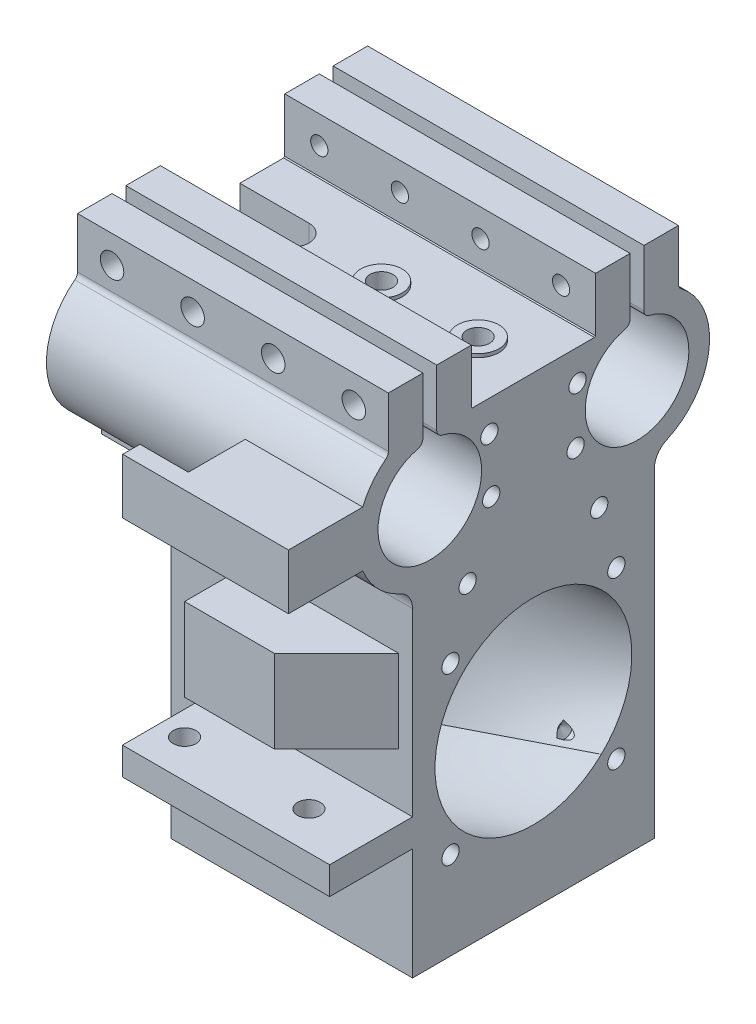
from build123d import *

# Parameters (mm, degrees)
BOSS_EXTRUDE1_DEPTH             = 35
BOSS_EXTRUDE1_DEPTH_BACK        = 10
SKETCH2_R                       = 7.5
CUT_EXTRUDE1_REACH              = 81.895
SKETCH4_R                       = 2.5
SKETCH10_W                      = 5
SKETCH10_H                      = 24.441838285
CUT_EXTRUDE2_DEPTH              = 61.815622993
CUT_EXTRUDE3_DEPTH              = 3
CUT_EXTRUDE20_START             = -10
SKETCH84_W                      = 35
SKETCH84_H                      = 45.7
CUT_EXTRUDE20_DEPTH             = 10
FILLET2_R                       = 3
SKETCH74_W                      = 13
SKETCH74_H                      = 12
PCB_MOUNT_DEPTH                 = 9
SKETCH65_W                      = 25
SKETCH65_H                      = 4
BOSS_EXTRUDE18_DEPTH            = 12
M4X0_7_TAPPED_HOLE6_D           = 3.3
M4X0_7_TAPPED_HOLE6_DEPTH       = 4
M4X0_7_TAPPED_HOLE4_D           = 3.3
M4X0_7_TAPPED_HOLE4_DEPTH       = 20
M4X0_7_TAPPED_HOLE4_TIP         = 0.991420021
SKETCH37_R                      = 3
SKETCH37_R_2                    = 1.65
BOSS_EXTRUDE11_DEPTH            = 0.5
M3X0_5_TAPPED_HOLE1_D           = 2.5
M3X0_5_TAPPED_HOLE1_DEPTH       = 7.5
M3X0_5_TAPPED_HOLE1_TIP         = 0.751075774
F_22_0_157_DIAMETER_HOLE1_D     = 3.9878
F_22_0_157_DIAMETER_HOLE1_DEPTH = 7.5
F_22_0_157_DIAMETER_HOLE1_TIP   = 1.198055988
M3X0_5_TAPPED_HOLE4_D           = 2.5
CHAMFER3_SIZE                   = 9
SKETCH100_W                     = 10.75
SKETCH100_H                     = 8
BOSS_EXTRUDE25_DEPTH            = 17
SKETCH101_W                     = 2.5
SKETCH101_H                     = 8
BOSS_EXTRUDE26_DEPTH            = 7
SKETCH105_W                     = 12
SKETCH105_H                     = 4
BOSS_EXTRUDE27_DEPTH            = 5
BOSS_EXTRUDE29_START            = -45
BOSS_EXTRUDE29_DEPTH            = 45
SKETCH107_W                     = 2
SKETCH107_H                     = 9.019238106
CUT_EXTRUDE23_DEPTH             = 72.453320969
M3_CLEARANCE_HOLE1_D            = 3.4
M3_CLEARANCE_HOLE1_DEPTH        = 5
M3X0_5_TAPPED_HOLE6_D           = 2.5
FILLET21_R                      = 1
M3X0_5_START                    = -18
M3X0_5_TAPPED_HOLE7_OUTLINE_R   = 1.25
M3X0_5_TAPPED_HOLE7_DEPTH       = 8.176239335


with BuildPart() as part:
    # Sketch2 → Boss-Extrude1 (new, two sides: drawn at the far end of the back side and taken through both)
    with BuildSketch(Plane(origin=(0, 0, 0), x_dir=(0, 0, -1), z_dir=(1, 0, 0)).offset(-BOSS_EXTRUDE1_DEPTH_BACK)):
        with BuildLine():
            Line((-17.5, -42.7), (-17.5, 5.743799258))
            ThreePointArc((-17.5, 5.743799258), (-24.526864561, 20.356456234), (-8.835585997, 24.441838285))
            Line((-8.835585997, 24.441838285), (8.835585997, 24.441838285))
            ThreePointArc((8.835585997, 24.441838285), (24.526864561, 20.356456234), (17.5, 5.743799258))
            Line((17.5, 5.743799258), (17.5, -42.7))
            Line((17.5, -42.7), (-17.5, -42.7))
        make_face()
        with Locations(Location((-15, 15.941838285, 0), (0, 0, 180))):
            Circle(SKETCH2_R, mode=Mode.SUBTRACT)
        with Locations((15, 15.941838285)):
            Circle(SKETCH2_R, mode=Mode.SUBTRACT)
    extrude(amount=BOSS_EXTRUDE1_DEPTH + BOSS_EXTRUDE1_DEPTH_BACK)

    # Sketch3 → Cut-Revolve3 (revolve, cut)
    with BuildSketch(Plane(origin=(0, 0, 0), x_dir=(0, 0, -1), z_dir=(1, 0, 0))):
        Polygon((8.75, 0), (8.75, -3.7), (6.3, -3.7), (6.3, -9.3), (9.75, -9.3), (9.75, -16.7), (12.5, -16.7), (12.5, -42.7), (0, -42.7), (0, 0), align=None)
    revolve(axis=Axis((0, 0, 0), (0, 1, 0)), mode=Mode.SUBTRACT)

    # Sketch4 → Cut-Extrude1 (cut, up to next)
    with BuildSketch(Plane(origin=(0, 24.441838285, 0), x_dir=(1, 0, 0), z_dir=(0, 1, 0)), mode=Mode.PRIVATE) as cut_extrude1_sk1:
        with Locations(Location((0, 0, 0), (0, 0, 270))):
            Circle(SKETCH4_R)
    cut_extrude1_tool1 = extrude(cut_extrude1_sk1.sketch, amount=-CUT_EXTRUDE1_REACH, mode=Mode.PRIVATE) & part.part
    add(cut_extrude1_tool1.solids().sort_by_distance((0, 24.441838, 0))[0], mode=Mode.SUBTRACT)

    # Sketch10 → Cut-Extrude2 (cut, through all)
    with BuildSketch(Plane(origin=(0, 0, 0), x_dir=(0, 0, -1), z_dir=(1, 0, 0))):
        Polygon((2.5, 0), (-2.5, 0), (-8.75, 0), (-8.75, -3.7), (-6.3, -3.7), (-6.3, -9.3), (-9.75, -9.3), (-9.75, -15.7), (-12.5, -15.7), (-12.5, -42.7), (12.5, -42.7), (12.5, -15.7), (9.75, -15.7), (9.75, -9.3), (6.3, -9.3), (6.3, -3.7), (8.75, -3.7), (8.75, 0), align=None)
        with Locations((0, 12.220919143)):
            Rectangle(SKETCH10_W, SKETCH10_H)
    extrude(amount=-CUT_EXTRUDE2_DEPTH, mode=Mode.SUBTRACT)

    # Sketch13 → Cut-Extrude3 (cut)
    with BuildSketch(Plane.XZ):
        with BuildLine():
            Line((-10, -8.75), (0, -8.75))
            ThreePointArc((0, -8.75), (8.75, 0), (0, 8.75))
            Line((0, 8.75), (-10, 8.75))
            Line((-10, 8.75), (-10, 2.5))
            Line((-10, 2.5), (0, 2.5))
            ThreePointArc((0, 2.5), (2.5, 0), (0, -2.5))
            Line((0, -2.5), (-10, -2.5))
            Line((-10, -2.5), (-10, -8.75))
        make_face()
    extrude(amount=-CUT_EXTRUDE3_DEPTH, mode=Mode.SUBTRACT)

    # Sketch84 → Cut-Extrude20 (cut)
    with BuildSketch(Plane.ZY.offset(10).offset(CUT_EXTRUDE20_START)):
        with Locations((0, -19.85)):
            Rectangle(SKETCH84_W, SKETCH84_H)
    extrude(amount=CUT_EXTRUDE20_DEPTH, mode=Mode.SUBTRACT)

    # Fillet2
    fillet2_edges = [part.edges().sort_by_distance(p)[0] for p in [
        (12.5, 5.743799258, -17.5),
        (12.5, 5.743799258, 17.5),
    ]]
    fillet(fillet2_edges, radius=FILLET2_R)

    # Cut-Loft1: read off the stored shape, not the designer's step
    # Cut-Loft1: loft between two sections, ruled curve by curve
    cut_loft1_from = [
        Edge.make_bspline([(35, -28.318965517, 9.827586207), (35, -27.725921522, 10.450282402), (35, -27.052656621, 11.043685723), (35, -25.553123726, 12.118742023), (35, -24.726745985, 12.600017847), (35, -22.951302796, 13.397543129), (35, -22.002378949, 13.713355273), (35, -20.035452072, 14.139734261), (35, -19.017857143, 14.25), (35, -16.982142857, 14.25), (35, -15.964547928, 14.139734261), (35, -13.997621051, 13.713355273), (35, -13.048697204, 13.397543129), (35, -11.273254015, 12.600017847), (35, -10.446876274, 12.118742023), (35, -8.947343379, 11.043685723), (35, -8.274078478, 10.450282402), (35, -7.681034483, 9.827586207)], [0, 0, 0, 0, 0.125, 0.125, 0.25, 0.25, 0.375, 0.375, 0.5, 0.5, 0.625, 0.625, 0.75, 0.75, 0.875, 0.875, 1, 1, 1, 1], 3),
        Edge.make_bspline([(35, -7.681034483, -9.827586207), (35, -8.274078478, -10.450282402), (35, -8.947343379, -11.043685723), (35, -10.446876274, -12.118742023), (35, -11.273254015, -12.600017847), (35, -13.048697204, -13.397543129), (35, -13.997621051, -13.713355273), (35, -15.964547928, -14.139734261), (35, -16.982142857, -14.25), (35, -19.017857143, -14.25), (35, -20.035452072, -14.139734261), (35, -22.002378949, -13.713355273), (35, -22.951302796, -13.397543129), (35, -24.726745985, -12.600017847), (35, -25.553123726, -12.118742023), (35, -27.052656621, -11.043685723), (35, -27.725921522, -10.450282402), (35, -28.318965517, -9.827586207)], [0, 0, 0, 0, 0.125, 0.125, 0.25, 0.25, 0.375, 0.375, 0.5, 0.5, 0.625, 0.625, 0.75, 0.75, 0.875, 0.875, 1, 1, 1, 1], 3),
        Edge.make_bspline([(35, -28.318965517, -9.827586207), (35, -28.883769322, -9.234542212), (35, -29.417031395, -8.571669051), (35, -30.376546587, -7.116404343), (35, -30.802514793, -6.323964497), (35, -31.505177515, -4.637573964), (35, -31.781565533, -3.743750613), (35, -32.154078032, -1.899813744), (35, -32.25, -0.95), (35, -32.25, 0.95), (35, -32.154078032, 1.899813744), (35, -31.781565533, 3.743750613), (35, -31.505177515, 4.637573964), (35, -30.802514793, 6.323964497), (35, -30.376546587, 7.116404343), (35, -29.417031395, 8.571669051), (35, -28.883769322, 9.234542212), (35, -28.318965517, 9.827586207)], [0, 0, 0, 0, 0.125, 0.125, 0.25, 0.25, 0.375, 0.375, 0.5, 0.5, 0.625, 0.625, 0.75, 0.75, 0.875, 0.875, 1, 1, 1, 1], 3),
        Edge.make_bspline([(35, -7.681034483, 9.827586207), (35, -7.116230678, 9.234542212), (35, -6.582968605, 8.571669051), (35, -5.623453413, 7.116404343), (35, -5.197485207, 6.323964497), (35, -4.494822485, 4.637573964), (35, -4.218434467, 3.743750613), (35, -3.845921968, 1.899813744), (35, -3.75, 0.95), (35, -3.75, -0.95), (35, -3.845921968, -1.899813744), (35, -4.218434467, -3.743750613), (35, -4.494822485, -4.637573964), (35, -5.197485207, -6.323964497), (35, -5.623453413, -7.116404343), (35, -6.582968605, -8.571669051), (35, -7.116230678, -9.234542212), (35, -7.681034483, -9.827586207)], [0, 0, 0, 0, 0.125, 0.125, 0.25, 0.25, 0.375, 0.375, 0.5, 0.5, 0.625, 0.625, 0.75, 0.75, 0.875, 0.875, 1, 1, 1, 1], 3),
    ]
    cut_loft1_to = [
        Edge.make_bspline([(0, -41.95, 12.5), (0, -40.85625, 12.5), (0, -39.7625, 12.5), (0, -37.575, 12.5), (0, -36.48125, 12.5), (0, -34.29375, 12.5), (0, -33.2, 12.5), (0, -31.0125, 12.5), (0, -29.91875, 12.5), (0, -27.73125, 12.5), (0, -26.6375, 12.5), (0, -24.45, 12.5), (0, -23.35625, 12.5), (0, -21.16875, 12.5), (0, -20.075, 12.5), (0, -17.8875, 12.5), (0, -16.79375, 12.5), (0, -15.7, 12.5)], [0, 0, 0, 0, 0.125, 0.125, 0.25, 0.25, 0.375, 0.375, 0.5, 0.5, 0.625, 0.625, 0.75, 0.75, 0.875, 0.875, 1, 1, 1, 1], 3),
        Edge.make_bspline([(0, -15.7, -12.5), (0, -16.79375, -12.5), (0, -17.8875, -12.5), (0, -20.075, -12.5), (0, -21.16875, -12.5), (0, -23.35625, -12.5), (0, -24.45, -12.5), (0, -26.6375, -12.5), (0, -27.73125, -12.5), (0, -29.91875, -12.5), (0, -31.0125, -12.5), (0, -33.2, -12.5), (0, -34.29375, -12.5), (0, -36.48125, -12.5), (0, -37.575, -12.5), (0, -39.7625, -12.5), (0, -40.85625, -12.5), (0, -41.95, -12.5)], [0, 0, 0, 0, 0.125, 0.125, 0.25, 0.25, 0.375, 0.375, 0.5, 0.5, 0.625, 0.625, 0.75, 0.75, 0.875, 0.875, 1, 1, 1, 1], 3),
        Edge.make_bspline([(0, -41.95, -12.5), (0, -41.95, -11.458333333), (0, -41.95, -10.416666667), (0, -41.95, -8.333333333), (0, -41.95, -7.291666667), (0, -41.95, -5.208333333), (0, -41.95, -4.166666667), (0, -41.95, -2.083333333), (0, -41.95, -1.041666667), (0, -41.95, 1.041666667), (0, -41.95, 2.083333333), (0, -41.95, 4.166666667), (0, -41.95, 5.208333333), (0, -41.95, 7.291666667), (0, -41.95, 8.333333333), (0, -41.95, 10.416666667), (0, -41.95, 11.458333333), (0, -41.95, 12.5)], [0, 0, 0, 0, 0.125, 0.125, 0.25, 0.25, 0.375, 0.375, 0.5, 0.5, 0.625, 0.625, 0.75, 0.75, 0.875, 0.875, 1, 1, 1, 1], 3),
        Edge.make_bspline([(0, -15.7, 12.5), (0, -15.7, 11.458333333), (0, -15.7, 10.416666667), (0, -15.7, 8.333333333), (0, -15.7, 7.291666667), (0, -15.7, 5.208333333), (0, -15.7, 4.166666667), (0, -15.7, 2.083333333), (0, -15.7, 1.041666667), (0, -15.7, -1.041666667), (0, -15.7, -2.083333333), (0, -15.7, -4.166666667), (0, -15.7, -5.208333333), (0, -15.7, -7.291666667), (0, -15.7, -8.333333333), (0, -15.7, -10.416666667), (0, -15.7, -11.458333333), (0, -15.7, -12.5)], [0, 0, 0, 0, 0.125, 0.125, 0.25, 0.25, 0.375, 0.375, 0.5, 0.5, 0.625, 0.625, 0.75, 0.75, 0.875, 0.875, 1, 1, 1, 1], 3),
    ]
    cut_loft1 = Solid(Shell([*[Face.make_surface_from_curves(cut_loft1_from[k], cut_loft1_to[k]) for k in range(4)], Face(Wire(cut_loft1_from)), Face(Wire(cut_loft1_to))]))
    add(cut_loft1, mode=Mode.SUBTRACT)

    # Sketch74 → PCB Mount (add)
    with BuildSketch(Plane.XY.offset(17.5)):
        with Locations((17.5, -9)):
            Rectangle(SKETCH74_W, SKETCH74_H)
    extrude(amount=PCB_MOUNT_DEPTH)

    # Sketch65 → Boss-Extrude18 (add)
    with BuildSketch(Plane.XY.offset(17.5)):
        with Locations((17.5, -24.5)):
            Rectangle(SKETCH65_W, SKETCH65_H)
    extrude(amount=BOSS_EXTRUDE18_DEPTH)

    # M4x0.7 Tapped Hole6
    with Locations(Plane(origin=(0, -22.5, 0), x_dir=(1, 0, 0), z_dir=(0, 1, 0))):
        with Locations((8.5, -24), (26.5, -24)):
            Hole(M4X0_7_TAPPED_HOLE6_D / 2, depth=M4X0_7_TAPPED_HOLE6_DEPTH)

    # M4x0.7 Tapped Hole4
    with Locations(Plane(origin=(0, 24.441838285, 0), x_dir=(1, 0, 0), z_dir=(0, 1, 0))):
        with Locations((27, 0), (13, 0)):
            Hole(M4X0_7_TAPPED_HOLE4_D / 2, depth=M4X0_7_TAPPED_HOLE4_DEPTH)
            with Locations((0, 0, -(M4X0_7_TAPPED_HOLE4_DEPTH + M4X0_7_TAPPED_HOLE4_TIP / 2))):  # 118° drill point
                Cone(0, M4X0_7_TAPPED_HOLE4_D / 2, M4X0_7_TAPPED_HOLE4_TIP, mode=Mode.SUBTRACT)

    # Sketch37 → Boss-Extrude11 (add)
    # profile 1 of 2: a face of its own
    with BuildSketch(Plane(origin=(0, 24.441838285, 0), x_dir=(1, 0, 0), z_dir=(0, 1, 0))):
        with Locations(Location((13, 0, 0), (0, 0, 270))):
            Circle(SKETCH37_R)
        with Locations(Location((13, 0, 0), (0, 0, 270))):
            Circle(SKETCH37_R_2, mode=Mode.SUBTRACT)
    # profile 2 of 2: a face of its own
    with BuildSketch(Plane(origin=(0, 24.441838285, 0), x_dir=(1, 0, 0), z_dir=(0, 1, 0))):
        with Locations(Location((27, 0, 0), (0, 0, 270))):
            Circle(SKETCH37_R)
        with Locations(Location((27, 0, 0), (0, 0, 270))):
            Circle(SKETCH37_R_2, mode=Mode.SUBTRACT)
    extrude(amount=BOSS_EXTRUDE11_DEPTH)

    # M3x0.5 Tapped Hole1
    with Locations(Plane(origin=(35, 0, 0), x_dir=(0, 0, -1), z_dir=(1, 0, 0))):
        with Locations((-12, -6), (12, -6), (12, -30), (-12, -30), (-9.525, 2.76683828), (9.525, 2.76683828)):
            Hole(M3X0_5_TAPPED_HOLE1_D / 2, depth=M3X0_5_TAPPED_HOLE1_DEPTH)
            with Locations((0, 0, -(M3X0_5_TAPPED_HOLE1_DEPTH + M3X0_5_TAPPED_HOLE1_TIP / 2))):  # 118° drill point
                Cone(0, M3X0_5_TAPPED_HOLE1_D / 2, M3X0_5_TAPPED_HOLE1_TIP, mode=Mode.SUBTRACT)

    # #22 (0.157) Diameter Hole1
    with Locations(Plane.ZY):
        with Locations((-13, -6.5), (13, -6.5)):
            Hole(F_22_0_157_DIAMETER_HOLE1_D / 2, depth=F_22_0_157_DIAMETER_HOLE1_DEPTH)
            with Locations((0, 0, -(F_22_0_157_DIAMETER_HOLE1_DEPTH + F_22_0_157_DIAMETER_HOLE1_TIP / 2))):  # 118° drill point
                Cone(0, F_22_0_157_DIAMETER_HOLE1_D / 2, F_22_0_157_DIAMETER_HOLE1_TIP, mode=Mode.SUBTRACT)

    # M3x0.5 Tapped Hole4 (through all)
    with Locations(Plane.ZY.offset(10)):
        with Locations((-6.108290378, 11.941838285), (6.108290378, 11.941838285), (-6.38315603, 19.941838285), (6.38315603, 19.941838285)):
            Hole(M3X0_5_TAPPED_HOLE4_D / 2)

    # Chamfer3
    chamfer3_edges = [part.edges().sort_by_distance(p)[0] for p in [
        (24, -9, 17.5),
    ]]
    chamfer(chamfer3_edges, length=CHAMFER3_SIZE - 0.0001)  # a hair under: the kernel refuses the full size

    # Sketch100 → Boss-Extrude25 (add)
    with BuildSketch(Plane(origin=(35, 0, 0), x_dir=(0, 0, -1), z_dir=(1, 0, 0))):
        with Locations((-30.083243919, 15.941838285)):
            Rectangle(SKETCH100_W, SKETCH100_H)
    extrude(amount=-BOSS_EXTRUDE25_DEPTH)

    # Sketch101 → Boss-Extrude26 (add)
    with BuildSketch(Plane.ZY.offset(-18)):
        with Locations((34.208243919, 15.941838285)):
            Rectangle(SKETCH101_W, SKETCH101_H)
    extrude(amount=BOSS_EXTRUDE26_DEPTH)

    # Sketch105 → Boss-Extrude27 (add)
    with BuildSketch(Plane(origin=(30, 0, 0), x_dir=(0, 0, -1), z_dir=(1, 0, 0))):
        with Locations((-23.5, -24.5)):
            Rectangle(SKETCH105_W, SKETCH105_H)
    extrude(amount=BOSS_EXTRUDE27_DEPTH)

    # Sketch106 → Boss-Extrude29 (add)
    with BuildSketch(Plane(origin=(35, 0, 0), x_dir=(0, 0, -1), z_dir=(1, 0, 0)).offset(BOSS_EXTRUDE29_START)):
        with BuildLine():
            ThreePointArc((-21, 24.558682255), (-18.618314449, 25.79870394), (-16, 26.394110765))
            Line((-16, 26.394110765), (-16, 32.394110765))
            Line((-16, 32.394110765), (-21, 32.394110765))
            Line((-21, 32.394110765), (-21, 24.558682255))
        make_face()
        with BuildLine():
            ThreePointArc((-14, 26.394110765), (-11.381685551, 25.79870394), (-9, 24.558682255))
            Line((-9, 24.558682255), (-9, 32.394110765))
            Line((-9, 32.394110765), (-14, 32.394110765))
            Line((-14, 32.394110765), (-14, 26.394110765))
        make_face()
    boss_extrude29 = extrude(amount=BOSS_EXTRUDE29_DEPTH)

    # Sketch107 → Cut-Extrude23 (cut, through all)
    with BuildSketch(Plane(origin=(35, 0, 0), x_dir=(0, 0, -1), z_dir=(1, 0, 0))):
        with Locations((-15, 27.884491712)):
            Rectangle(SKETCH107_W, SKETCH107_H)
    cut_extrude23 = extrude(amount=-CUT_EXTRUDE23_DEPTH, mode=Mode.SUBTRACT)

    # M3 Clearance Hole1
    with Locations(Plane.XY.offset(21)):
        with Locations((-5, 28.394110765), (6.666666667, 28.394110765), (18.333333333, 28.394110765), (30, 28.394110765)):
            m3_clearance_hole1 = Hole(M3_CLEARANCE_HOLE1_D / 2, depth=M3_CLEARANCE_HOLE1_DEPTH)

    # M3x0.5 Tapped Hole6 (through all)
    with Locations(Plane.XY.offset(14)):
        with Locations((-5, 28.394110765), (6.666666667, 28.394110765), (18.333333333, 28.394110765), (30, 28.394110765)):
            m3x0_5_tapped_hole6 = Hole(M3X0_5_TAPPED_HOLE6_D / 2)

    # Mirror6: Boss-Extrude29, Cut-Extrude23, M3 Clearance Hole1, M3x0.5 Tapped Hole6 across plane
    add(boss_extrude29.mirror(Plane.XY))
    add(cut_extrude23.mirror(Plane.XY), mode=Mode.SUBTRACT)
    add(m3_clearance_hole1.mirror(Plane.XY), mode=Mode.SUBTRACT)
    add(m3x0_5_tapped_hole6.mirror(Plane.XY), mode=Mode.SUBTRACT)

    # Fillet21
    fillet21_edges = [part.edges().sort_by_distance(p)[0] for p in [
        (12.5, 24.558682255, 21),
        (12.5, 23.374872659, 16),
        (12.5, 23.374872659, 14),
        (12.5, 24.558682255, -21),
        (12.5, 23.374872659, -16),
        (12.5, 23.374872659, -14),
    ]]
    fillet(fillet21_edges, radius=FILLET21_R)

    # M3x0.5 Tapped Hole7: read off the stored shape, not the designer's step
    # M3x0.5 Tapped Hole7 outline → M3x0.5 Tapped Hole7 (cut)
    with BuildSketch(Plane.XY.offset(M3X0_5_START)):
        with Locations((7, -38.693494861)):
            Circle(M3X0_5_TAPPED_HOLE7_OUTLINE_R)
        with Locations((7, -30.693494861)):
            Circle(M3X0_5_TAPPED_HOLE7_OUTLINE_R)
    extrude(amount=M3X0_5_TAPPED_HOLE7_DEPTH, mode=Mode.SUBTRACT)


solid = part.part
